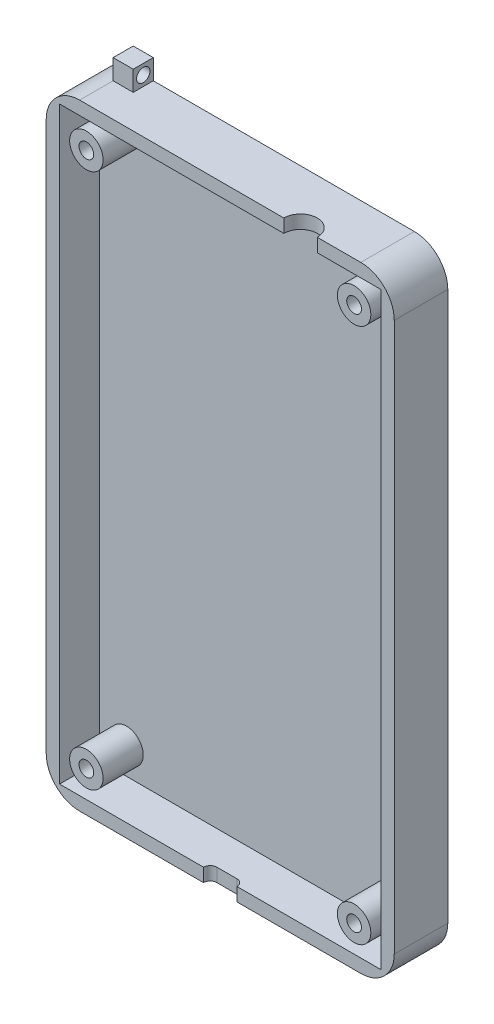
from build123d import *

# Parameters (mm, degrees)
SKETCH1_W           = 52
SKETCH1_H           = 92
SKETCH1_W_2         = 48
SKETCH1_H_2         = 88
EXTRUDE_THIN1_DEPTH = 8
SKETCH2_W           = 48
SKETCH2_H           = 88
BOSS_EXTRUDE1_DEPTH = 2
FILLET1_R           = 5
SKETCH3_R           = 2.5
SKETCH3_R_2         = 1.1
BOSS_EXTRUDE2_DEPTH = 6
SKETCH4_R           = 2.5
CUT_EXTRUDE1_DEPTH  = 10
SKETCH5_W           = 5
SKETCH5_H           = 2
CUT_EXTRUDE2_DEPTH  = 10
FILLET2_R           = 1
SKETCH6_W           = 3
SKETCH6_H           = 3
BOSS_EXTRUDE3_DEPTH = 3
SKETCH7_R           = 1
CUT_EXTRUDE3_DEPTH  = 3


with BuildPart() as part:
    # Sketch1 → Extrude-Thin1 (new body)
    with BuildSketch(Plane.XY):
        Rectangle(SKETCH1_W, SKETCH1_H)
        Rectangle(SKETCH1_W_2, SKETCH1_H_2, mode=Mode.SUBTRACT)
    extrude(amount=EXTRUDE_THIN1_DEPTH)

    # Sketch2 → Boss-Extrude1 (add)
    with BuildSketch(Plane.XY):
        Rectangle(SKETCH2_W, SKETCH2_H)
    extrude(amount=BOSS_EXTRUDE1_DEPTH)

    # Fillet1
    fillet1_edges = [part.edges().sort_by_distance(p)[0] for p in [
        (-26, 46, 4),
        (26, 46, 4),
        (26, -46, 4),
        (-26, -46, 4),
    ]]
    fillet(fillet1_edges, radius=FILLET1_R)

    # Sketch3 → Boss-Extrude2 (add)
    # profile 1 of 4: a face of its own
    with BuildSketch(Plane.XY.offset(2)):
        with Locations((-20, 40)):
            Circle(SKETCH3_R)
        with Locations((-20, 40)):
            Circle(SKETCH3_R_2, mode=Mode.SUBTRACT)
    # profile 2 of 4: a face of its own
    with BuildSketch(Plane.XY.offset(2)):
        with Locations((-20, -40)):
            Circle(SKETCH3_R)
        with Locations((-20, -40)):
            Circle(SKETCH3_R_2, mode=Mode.SUBTRACT)
    # profile 3 of 4: a face of its own
    with BuildSketch(Plane.XY.offset(2)):
        with Locations((20, -40)):
            Circle(SKETCH3_R)
        with Locations((20, -40)):
            Circle(SKETCH3_R_2, mode=Mode.SUBTRACT)
    # profile 4 of 4: a face of its own
    with BuildSketch(Plane.XY.offset(2)):
        with Locations((20, 40)):
            Circle(SKETCH3_R)
        with Locations((20, 40)):
            Circle(SKETCH3_R_2, mode=Mode.SUBTRACT)
    extrude(amount=BOSS_EXTRUDE2_DEPTH)

    # Sketch4 → Cut-Extrude1 (cut)
    with BuildSketch(Plane(origin=(0, 46, 0), x_dir=(1, 0, 0), z_dir=(0, 1, 0))):
        with Locations((12, -8)):
            Circle(SKETCH4_R)
    extrude(amount=-CUT_EXTRUDE1_DEPTH, mode=Mode.SUBTRACT)

    # Sketch5 → Cut-Extrude2 (cut)
    with BuildSketch(Plane.XZ.offset(46)):
        with Locations((0, 8)):
            Rectangle(SKETCH5_W, SKETCH5_H)
    extrude(amount=-CUT_EXTRUDE2_DEPTH, mode=Mode.SUBTRACT)

    # Fillet2
    fillet2_edges = [part.edges().sort_by_distance(p)[0] for p in [
        (-2.5, -45, 7),
        (2.5, -45, 7),
    ]]
    fillet(fillet2_edges, radius=FILLET2_R - 0.0001)  # a hair under: the kernel refuses the full size

    # Sketch6 → Boss-Extrude3 (add)
    with BuildSketch(Plane(origin=(0, 46, 0), x_dir=(1, 0, 0), z_dir=(0, 1, 0))):
        with Locations((-19.5, -1.5)):
            Rectangle(SKETCH6_W, SKETCH6_H)
    extrude(amount=BOSS_EXTRUDE3_DEPTH)

    # Sketch7 → Cut-Extrude3 (cut)
    with BuildSketch(Plane.ZY.offset(21)):
        with Locations(Location((1.5, 47.5, 0), (0, 0, 270))):
            Circle(SKETCH7_R)
    extrude(amount=-CUT_EXTRUDE3_DEPTH, mode=Mode.SUBTRACT)


solid = part.part
